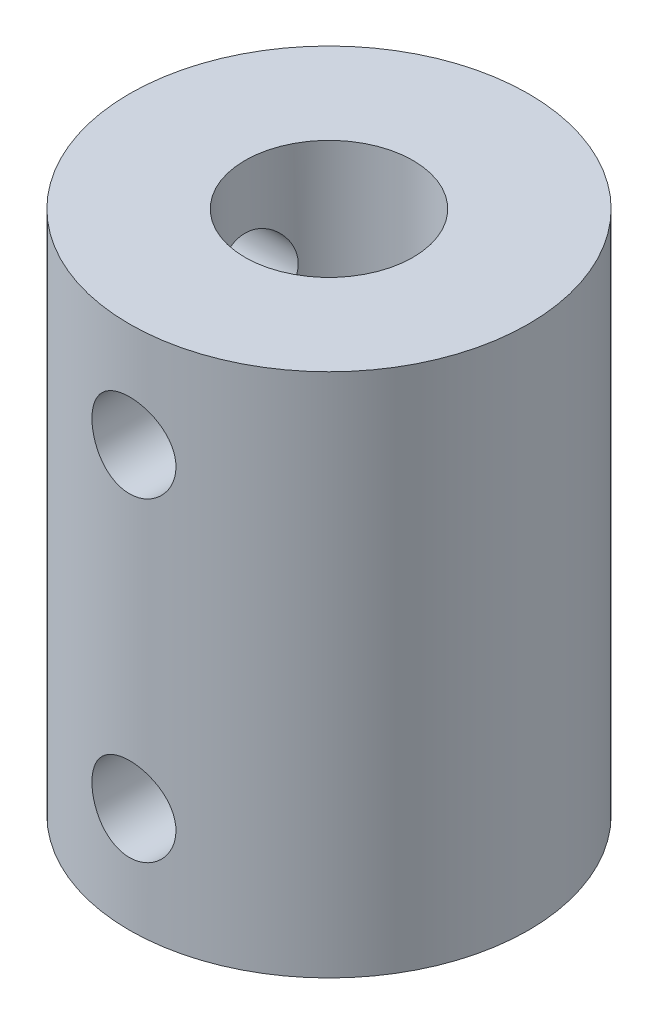
from build123d import *

# Parameters (mm, degrees)
SKETCH1_R           = 9.5
BOSS_EXTRUDE1_DEPTH = 25
SKETCH2_R           = 4
CUT_EXTRUDE1_DEPTH  = 25
SKETCH3_R           = 2
CUT_EXTRUDE2_DEPTH  = 10
SKETCH4_R           = 2
CUT_EXTRUDE3_DEPTH  = 10


with BuildPart() as part:
    # Sketch1 → Boss-Extrude1 (new body)
    with BuildSketch(Plane(origin=(0, 0, 0), x_dir=(1, 0, 0), z_dir=(0, 1, 0))):
        Circle(SKETCH1_R)
    extrude(amount=BOSS_EXTRUDE1_DEPTH)

    # Sketch2 → Cut-Extrude1 (cut)
    with BuildSketch(Plane(origin=(0, 25, 0), x_dir=(1, 0, 0), z_dir=(0, 1, 0))):
        Circle(SKETCH2_R)
    extrude(amount=-CUT_EXTRUDE1_DEPTH, mode=Mode.SUBTRACT)

    # Sketch3 → Cut-Extrude2 (cut)
    with BuildSketch(Plane.XY):
        with Locations((0, 20)):
            Circle(SKETCH3_R)
        with Locations((0, 5)):
            Circle(SKETCH3_R)
    extrude(amount=CUT_EXTRUDE2_DEPTH, mode=Mode.SUBTRACT)

    # Sketch4 → Cut-Extrude3 (cut)
    with BuildSketch(Plane(origin=(0, 0, 0), x_dir=(0, 0, -1), z_dir=(1, 0, 0))):
        with Locations((0, 20)):
            Circle(SKETCH4_R)
        with Locations((0, 5)):
            Circle(SKETCH4_R)
    extrude(amount=-CUT_EXTRUDE3_DEPTH, mode=Mode.SUBTRACT)


solid = part.part
